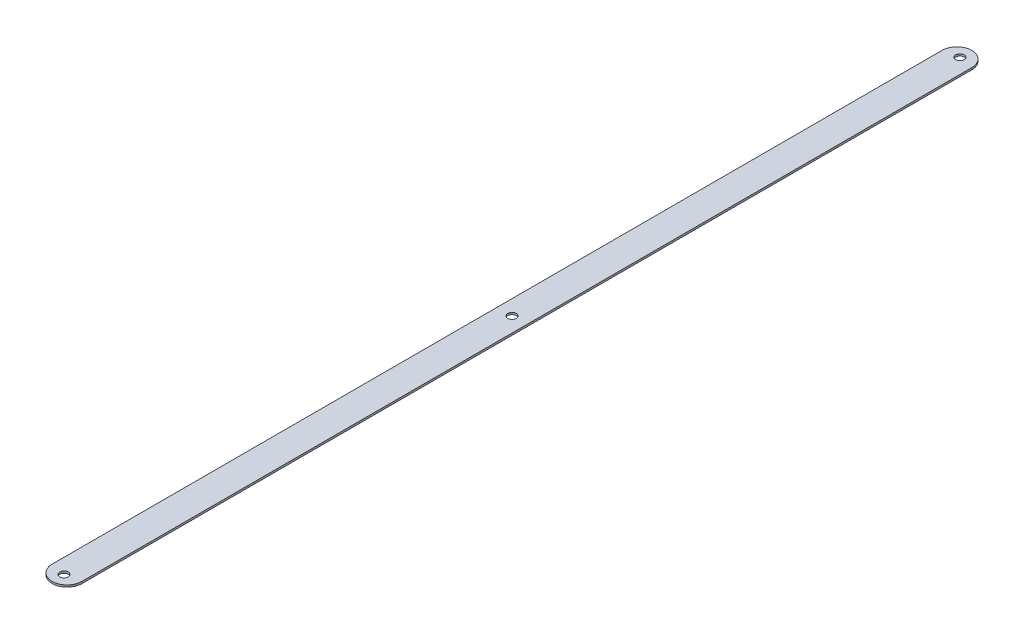
from build123d import *

# Parameters (mm, degrees)
SKETCH1_R           = 2.15
BOSS_EXTRUDE1_DEPTH = 1


with BuildPart() as part:
    # Sketch1 → Boss-Extrude1 (new body)
    with BuildSketch(Plane(origin=(0, 0, 0), x_dir=(1, 0, 0), z_dir=(0, 1, 0))):
        with BuildLine():
            ThreePointArc((7.5, 449.29), (0, 456.79), (-7.5, 449.29))
            Line((-7.5, 449.29), (-7.5, 1.5))
            ThreePointArc((-7.5, 1.5), (0, -6), (7.5, 1.5))
            Line((7.5, 1.5), (7.5, 449.29))
        make_face()
        Circle(SKETCH1_R, mode=Mode.SUBTRACT)
        with Locations((0, 225.395)):
            Circle(SKETCH1_R, mode=Mode.SUBTRACT)
        with Locations((0, 450.79)):
            Circle(SKETCH1_R, mode=Mode.SUBTRACT)
    extrude(amount=BOSS_EXTRUDE1_DEPTH)


solid = part.part
